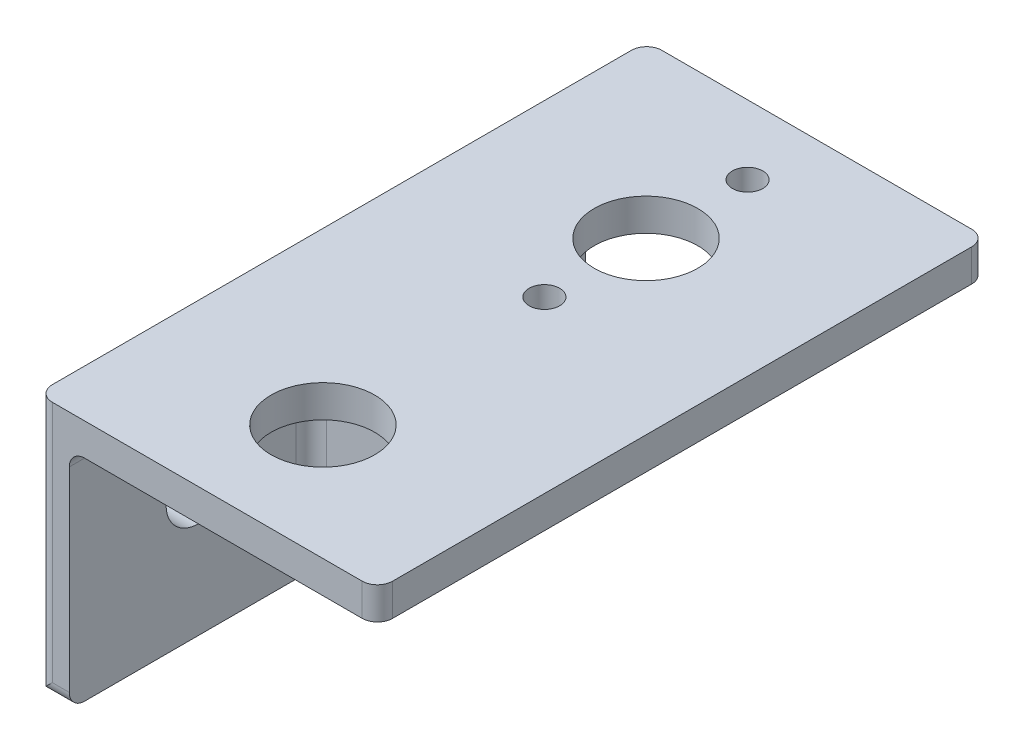
from build123d import *

# Parameters (mm, degrees)
SKETCH2_W           = 50.8
SKETCH2_H           = 25.4
BOSS_EXTRUDE1_DEPTH = 3.175
SKETCH4_W           = 33.5
SKETCH4_H           = 60
BOSS_EXTRUDE2_DEPTH = 3.175
SKETCH6_R           = 3.175
CUT_EXTRUDE2_DEPTH  = 3.175
BOSS_EXTRUDE3_DEPTH = 1.5875
SKETCH8_R           = 5.1
SKETCH8_R_2         = 1.5
CUT_EXTRUDE3_DEPTH  = 10
FILLET3_R           = 1.5


with BuildPart() as part:
    # Sketch2 → Boss-Extrude1 (new body)
    with BuildSketch(Plane(origin=(0, 0, 0), x_dir=(0, 0, -1), z_dir=(1, 0, 0))):
        Rectangle(SKETCH2_W, SKETCH2_H)
    extrude(amount=BOSS_EXTRUDE1_DEPTH)

    # Sketch4 → Boss-Extrude2 (add)
    with BuildSketch(Plane(origin=(0, 12.7, 0), x_dir=(1, 0, 0), z_dir=(0, 1, 0))):
        with Locations((16.75, 4.6)):
            Rectangle(SKETCH4_W, SKETCH4_H)
    extrude(amount=-BOSS_EXTRUDE2_DEPTH)

    # Sketch6 → Cut-Extrude2 (cut)
    with BuildSketch(Plane.ZY):
        with Locations((-12.7, 0)):
            Circle(SKETCH6_R)
        with Locations((12.7, 0)):
            Circle(SKETCH6_R)
    extrude(amount=-CUT_EXTRUDE2_DEPTH, mode=Mode.SUBTRACT)

    # Sketch7 → Boss-Extrude3 (add, symmetric)
    with BuildSketch(Plane.XY):
        Polygon((3.175, -12.7), (25.4, 9.525), (3.175, 9.525), align=None)
    extrude(amount=BOSS_EXTRUDE3_DEPTH, both=True)

    # Sketch8 → Cut-Extrude3 (cut)
    with BuildSketch(Plane(origin=(0, 12.7, 0), x_dir=(1, 0, 0), z_dir=(0, 1, 0))):
        with Locations(Location((16.75, 17.788109286, 0), (0, 0, 270))):
            Circle(SKETCH8_R)
        with Locations(Location((16.75, 7.788109286, 0), (0, 0, 270))):
            Circle(SKETCH8_R_2)
        with Locations(Location((16.75, 27.788109286, 0), (0, 0, 270))):
            Circle(SKETCH8_R_2)
        with Locations(Location((16.75, -14.014379277, 0), (0, 0, 270))):
            Circle(SKETCH8_R)
    extrude(amount=-CUT_EXTRUDE3_DEPTH, mode=Mode.SUBTRACT)

    # Fillet3
    # the kernel refuses this fillet: 1.5 mm, written as the material it adds along each edge
    with BuildSketch(Plane(origin=(4.675, 8.025, 3.0875), x_dir=(-1, 0, 0), z_dir=(0, 1, 0))) as fillet3_piece_1_section:
        Polygon((0, 0), (FILLET3_R, 0), (FILLET3_R, -FILLET3_R), (0, -FILLET3_R), align=None)
    fillet3_piece_1 = extrude(amount=FILLET3_R, mode=Mode.PRIVATE)
    fillet3_piece_1 = fillet3_piece_1 - Plane(origin=(4.675, 8.025, 3.0875), x_dir=(0.7071067811865475, 0, 0.7071067811865475), z_dir=(0, 1, 0)) * Sphere(FILLET3_R, mode=Mode.PRIVATE)
    add(fillet3_piece_1)
    with BuildSketch(Plane(origin=(4.675, 8.025, -3.0875), x_dir=(-1, 0, 0), z_dir=(0, 1, 0))) as fillet3_piece_2_section:
        Polygon((0, 0), (FILLET3_R, 0), (FILLET3_R, FILLET3_R), (0, FILLET3_R), align=None)
    fillet3_piece_2 = extrude(amount=FILLET3_R, mode=Mode.PRIVATE)
    fillet3_piece_2 = fillet3_piece_2 - Plane(origin=(4.675, 8.025, -3.0875), x_dir=(0.7071067811865475, 0, -0.7071067811865475), z_dir=(0, 1, 0)) * Sphere(FILLET3_R, mode=Mode.PRIVATE)
    add(fillet3_piece_2)
    with BuildSketch(Plane(origin=(3.175, 9.525, 25.4), x_dir=(0, -1, 0), z_dir=(0, 0, -1)), Plane(origin=(3.175, 9.525, -3.0875), x_dir=(0, -1, 0), z_dir=(0, 0, -1))) as fillet3_piece_3:
        with BuildLine():
            CenterArc((FILLET3_R, -FILLET3_R), FILLET3_R, 90, 90)
            Line((0, -FILLET3_R), (0, 0))
            Line((0, 0), (FILLET3_R, 0))
        make_face()
    extrude(amount=22.3125)
    with BuildSketch(Plane(origin=(29.15, 9.525, -1.5875), x_dir=(0, 0, -1), z_dir=(-1, 0, 0))) as fillet3_piece_4_section:
        with BuildLine():
            CenterArc((FILLET3_R, FILLET3_R), FILLET3_R, 180, 90)
            Line((0, FILLET3_R), (0, 0))
            Line((0, 0), (FILLET3_R, 0))
        make_face()
    fillet3_piece_4 = extrude(amount=24.475, mode=Mode.PRIVATE)
    fillet3_piece_4 = split(fillet3_piece_4, bisect_by=Plane(origin=(19.967902823, 4.092902823, -1.930123153), z_dir=(-0.707106781186549, 0.707106781186546, 0)), keep=Keep.TOP, mode=Mode.PRIVATE)
    add(fillet3_piece_4)
    with BuildSketch(Plane(origin=(25.4, 9.525, -1.5875), x_dir=(-0.7071067811865489, -0.7071067811865461, 0), z_dir=(0, 0, 1))) as fillet3_piece_5:
        with BuildLine():
            CenterArc((FILLET3_R * 0.414213562373, FILLET3_R), FILLET3_R, 225, 45)
            Line((-FILLET3_R * 0.292893218813, FILLET3_R * 0.292893218813), (0, 0))
            Line((0, 0), (FILLET3_R * 0.414213562373, 0))
        make_face()
    extrude(amount=3.175)
    with BuildSketch(Plane(origin=(3.175, 8.025, -1.5875), x_dir=(0, 0, -1), z_dir=(0, -1, 0))) as fillet3_piece_6_section:
        with BuildLine():
            CenterArc((FILLET3_R, FILLET3_R), FILLET3_R, 180, 90)
            Line((0, FILLET3_R), (0, 0))
            Line((0, 0), (FILLET3_R, 0))
        make_face()
    fillet3_piece_6 = extrude(amount=20.725, mode=Mode.PRIVATE)
    fillet3_piece_6 = split(fillet3_piece_6, bisect_by=Plane(origin=(8.60741784, -7.26758216, -1.930100054), z_dir=(-0.707106781186549, 0.707106781186546, 0)), keep=Keep.TOP, mode=Mode.PRIVATE)
    add(fillet3_piece_6)
    with BuildSketch(Plane(origin=(29.15, 9.525, 1.5875), x_dir=(0, 0, 1), z_dir=(-1, 0, 0))) as fillet3_piece_7_section:
        with BuildLine():
            CenterArc((FILLET3_R, -FILLET3_R), FILLET3_R, 90, 90)
            Line((0, -FILLET3_R), (0, 0))
            Line((0, 0), (FILLET3_R, 0))
        make_face()
    fillet3_piece_7 = extrude(amount=24.475, mode=Mode.PRIVATE)
    fillet3_piece_7 = split(fillet3_piece_7, bisect_by=Plane(origin=(19.967902823, 4.092902823, 1.930123153), z_dir=(-0.707106781186549, 0.707106781186546, 0)), keep=Keep.TOP, mode=Mode.PRIVATE)
    add(fillet3_piece_7)
    with BuildSketch(Plane(origin=(3.175, 8.025, 1.5875), x_dir=(0, 0, 1), z_dir=(0, -1, 0))) as fillet3_piece_8_section:
        with BuildLine():
            CenterArc((FILLET3_R, -FILLET3_R), FILLET3_R, 90, 90)
            Line((0, -FILLET3_R), (0, 0))
            Line((0, 0), (FILLET3_R, 0))
        make_face()
    fillet3_piece_8 = extrude(amount=20.725, mode=Mode.PRIVATE)
    fillet3_piece_8 = split(fillet3_piece_8, bisect_by=Plane(origin=(8.60741784, -7.26758216, 1.930100054), z_dir=(-0.707106781186549, 0.707106781186546, 0)), keep=Keep.TOP, mode=Mode.PRIVATE)
    add(fillet3_piece_8)
    with BuildSketch(Plane(origin=(25.4, 9.525, -3.140800859), x_dir=(-0.7071067811865446, -0.7071067811865503, 0), z_dir=(0, 0, 1))) as fillet3_piece_9a_section:
        with BuildLine():
            CenterArc((FILLET3_R * 0.414213562373, FILLET3_R), FILLET3_R, 225, 45)
            Line((-FILLET3_R * 0.292893218813, FILLET3_R * 0.292893218813), (0, 0))
            Line((0, 0), (FILLET3_R * 0.414213562373, 0))
        make_face()
    fillet3_piece_9a = extrude(amount=4.728300859, mode=Mode.PRIVATE)
    fillet3_piece_9a = split(fillet3_piece_9a, bisect_by=Plane(origin=(25.438403899, 9.432284787, -1.5875), z_dir=(0, 0, -1)), keep=Keep.TOP, mode=Mode.PRIVATE)
    with BuildSketch(Plane(origin=(29.15, 9.525, -1.5875), x_dir=(0, 0, -1), z_dir=(-1, 0, 0))) as fillet3_piece_9b_section:
        with BuildLine():
            CenterArc((FILLET3_R, FILLET3_R), FILLET3_R, 180, 90)
            Line((0, FILLET3_R), (0, 0))
            Line((0, 0), (FILLET3_R, 0))
        make_face()
    fillet3_piece_9b = extrude(amount=24.475, mode=Mode.PRIVATE)
    fillet3_piece_9b = split(fillet3_piece_9b, bisect_by=Plane(origin=(26.063627713, 10.188627713, -1.91198662), z_dir=(0.707106781186549, -0.707106781186546, 0)), keep=Keep.TOP, mode=Mode.PRIVATE)
    fillet3_piece_9 = fillet3_piece_9a & fillet3_piece_9b
    add(fillet3_piece_9)
    with BuildSketch(Plane(origin=(25.4, 9.525, -1.5875), x_dir=(-0.7071067811865489, -0.7071067811865461, 0), z_dir=(0, 0, 1))) as fillet3_piece_10a_section:
        with BuildLine():
            CenterArc((FILLET3_R * 0.414213562373, FILLET3_R), FILLET3_R, 225, 45)
            Line((-FILLET3_R * 0.292893218813, FILLET3_R * 0.292893218813), (0, 0))
            Line((0, 0), (FILLET3_R * 0.414213562373, 0))
        make_face()
    fillet3_piece_10a = extrude(amount=4.728300859, mode=Mode.PRIVATE)
    fillet3_piece_10a = split(fillet3_piece_10a, bisect_by=Plane(origin=(25.438403899, 9.432284787, 1.5875), z_dir=(0, 0, 1)), keep=Keep.TOP, mode=Mode.PRIVATE)
    with BuildSketch(Plane(origin=(29.15, 9.525, 1.5875), x_dir=(0, 0, 1), z_dir=(-1, 0, 0))) as fillet3_piece_10b_section:
        with BuildLine():
            CenterArc((FILLET3_R, -FILLET3_R), FILLET3_R, 90, 90)
            Line((0, -FILLET3_R), (0, 0))
            Line((0, 0), (FILLET3_R, 0))
        make_face()
    fillet3_piece_10b = extrude(amount=24.475, mode=Mode.PRIVATE)
    fillet3_piece_10b = split(fillet3_piece_10b, bisect_by=Plane(origin=(26.063627713, 10.188627713, 1.91198662), z_dir=(0.707106781186549, -0.707106781186546, 0)), keep=Keep.TOP, mode=Mode.PRIVATE)
    fillet3_piece_10 = fillet3_piece_10a & fillet3_piece_10b
    add(fillet3_piece_10)
    # the kernel refuses this fillet: 1.5 mm, written as the material it takes off along each edge
    with BuildSketch(Plane(origin=(33.5, 16.45, 25.4), x_dir=(0, 0, -1), z_dir=(0, -1, 0)), Plane(origin=(0, 16.45, -34.6), x_dir=(0, 0, 1), z_dir=(0, -1, 0)), Plane(origin=(33.5, 16.45, -34.6), x_dir=(-1, 0, 0), z_dir=(0, -1, 0)), Plane(origin=(-3.75, -12.7, -25.4), x_dir=(0, 0, 1), z_dir=(1, 0, 0))) as fillet3_2_piece_1:
        with BuildLine():
            CenterArc((FILLET3_R, -FILLET3_R), FILLET3_R, 90, 90)
            Line((0, -FILLET3_R), (0, 0))
            Line((0, 0), (FILLET3_R, 0))
        make_face()
    extrude(amount=10.675, mode=Mode.SUBTRACT)
    with BuildSketch(Plane(origin=(0, 16.45, 25.4), x_dir=(0, 0, -1), z_dir=(0, -1, 0))) as fillet3_2_piece_2:
        with BuildLine():
            CenterArc((FILLET3_R, FILLET3_R), FILLET3_R, 180, 90)
            Line((0, FILLET3_R), (0, 0))
            Line((0, 0), (FILLET3_R, 0))
        make_face()
    extrude(amount=32.9, mode=Mode.SUBTRACT)
    with BuildSketch(Plane(origin=(-3.75, -12.7, 25.4), x_dir=(0, 0, -1), z_dir=(1, 0, 0))) as fillet3_2_piece_3:
        with BuildLine():
            CenterArc((FILLET3_R, FILLET3_R), FILLET3_R, 180, 90)
            Line((0, FILLET3_R), (0, 0))
            Line((0, 0), (FILLET3_R, 0))
        make_face()
    extrude(amount=10.675, mode=Mode.SUBTRACT)


solid = part.part
